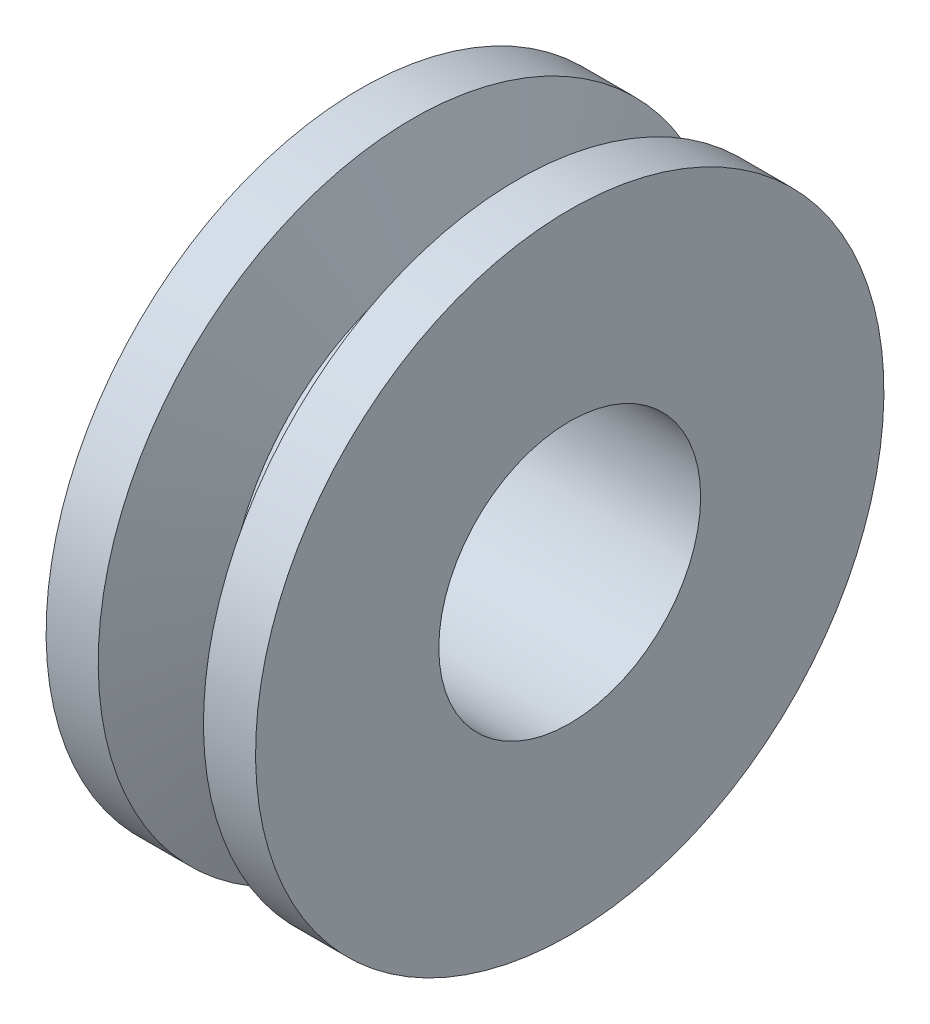
from build123d import *

# Parameters (mm, degrees)
SKETCH2_R          = 12.5
CUT_EXTRUDE4_DEPTH = 31


with BuildPart() as part:
    # Sketch1 → Revolve1 (revolve)
    with BuildSketch(Plane.XY):
        Polygon((-10, 0), (10, 0), (10, 30), (5.025732108, 30), (1.75, 21), (-1.75, 21), (-5.025732108, 30), (-10, 30), align=None)
    revolve(axis=Axis((-10, 0, 0), (1, 0, 0)))

    # Sketch2 → Cut-Extrude4 (cut)
    with BuildSketch(Plane(origin=(10, 0, 0), x_dir=(0, 0, -1), z_dir=(1, 0, 0))):
        Circle(SKETCH2_R)
    extrude(amount=-CUT_EXTRUDE4_DEPTH, mode=Mode.SUBTRACT)


solid = part.part
